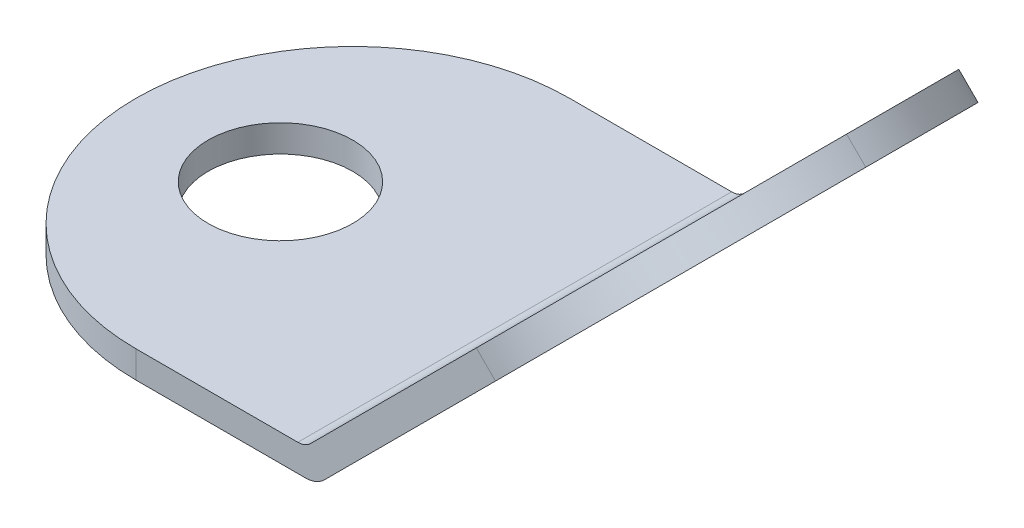
from build123d import *

# Parameters (mm, degrees)
ESTRUSIONE_SOTTILE1_DEPTH = 6
RACCORDO3_R               = 6
SCHIZZO4_R                = 2
TAGLIO_ESTRUSIONE1_DEPTH  = 0.75
TAGLIO_ESTRUSIONE2_DEPTH  = 0.75
RACCORDO1_R               = 0.75
RACCORDO2_R               = 0.5


with BuildPart() as part:
    # Schizzo1 → Estrusione-Sottile1 (new, symmetric)
    with BuildSketch(Plane.XY):
        Polygon((9.192388155, 9.192388155), (0, 0), (-11, 0), (-11, 0.75), (-0.310660172, 0.75), (8.66205807, 9.722718241), align=None)
    extrude(amount=ESTRUSIONE_SOTTILE1_DEPTH, both=True)

    # Raccordo3
    raccordo3_edges = [part.edges().sort_by_distance(p)[0] for p in [
        (-11, 0.375, 6),
        (-11, 0.375, -6),
        (8.927223112, 9.457553198, -6),
        (8.927223112, 9.457553198, 6),
    ]]
    fillet(raccordo3_edges, radius=RACCORDO3_R - 0.0001)  # a hair under: the kernel refuses the full size

    # Schizzo4 → Taglio-Estrusione1 (cut)
    with BuildSketch(Plane(origin=(0, 0.75, 0), x_dir=(1, 0, 0), z_dir=(0, 1, 0))):
        with Locations(Location((-7, 0, 0), (0, 0, 180))):
            Circle(SCHIZZO4_R)
    extrude(amount=-TAGLIO_ESTRUSIONE1_DEPTH, mode=Mode.SUBTRACT)

    # Schizzo5 → Taglio-Estrusione2 (cut)
    with BuildSketch(Plane(origin=(-0.530330086, 0.530330086, 0), x_dir=(0, 0, 1), z_dir=(-0.7071067811865491, 0.7071067811865459, 0))):
        with BuildLine():
            Line((2, 9), (2, 3.5))
            ThreePointArc((2, 3.5), (0, 1.5), (-2, 3.5))
            Line((-2, 3.5), (-2, 9))
            ThreePointArc((-2, 9), (0, 11), (2, 9))
        make_face()
    extrude(amount=-TAGLIO_ESTRUSIONE2_DEPTH, mode=Mode.SUBTRACT)

    # Raccordo1
    raccordo1_edges = [part.edges().sort_by_distance(p)[0] for p in [
        (0, 0, 0),
    ]]
    fillet(raccordo1_edges, radius=RACCORDO1_R)

    # Raccordo2
    raccordo2_edges = [part.edges().sort_by_distance(p)[0] for p in [
        (-0.310660172, 0.75, 0),
    ]]
    fillet(raccordo2_edges, radius=RACCORDO2_R)


solid = part.part
